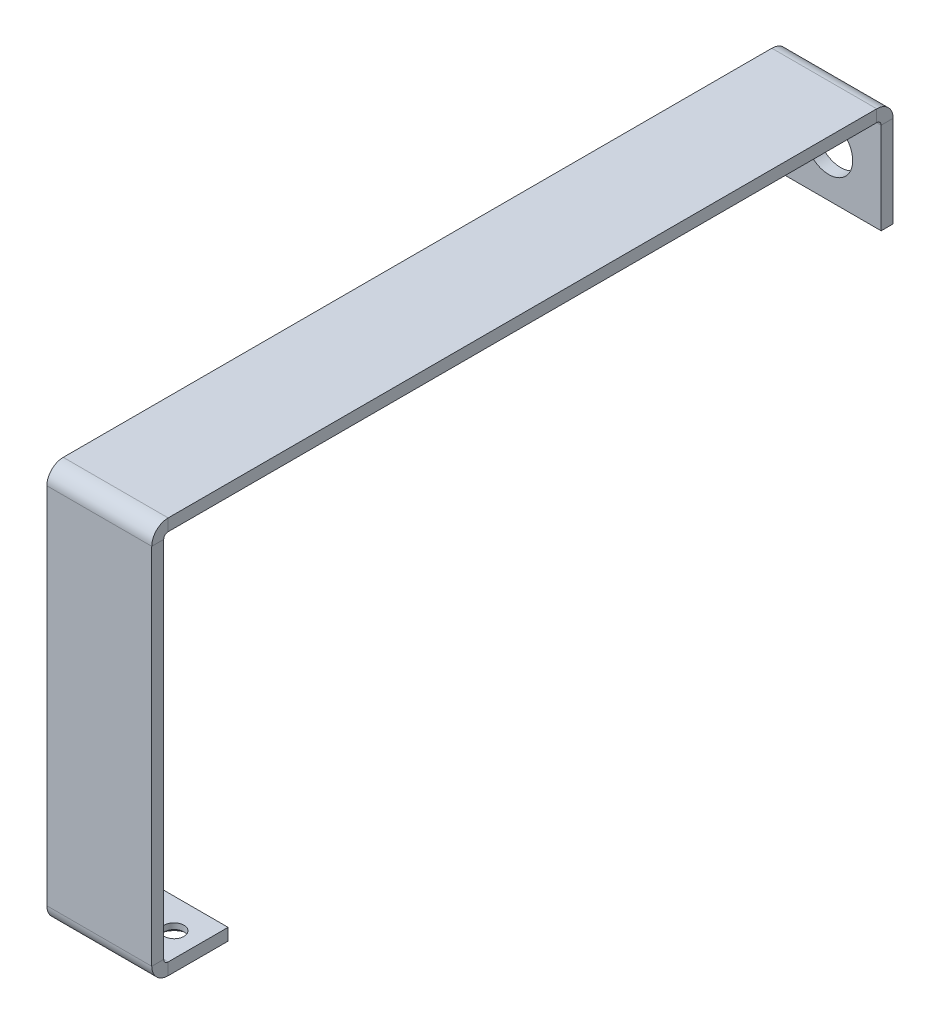
from build123d import *

# Parameters (mm, degrees)
SKETCH1_W                                         = 17.5
SKETCH1_H                                         = 10
BASE_FLANGE1_DEPTH                                = 2
EDGE_FLANGE1_DEPTH                                = 17.5
EDGE_FLANGE2_STRIP_W                              = 9.4732
EDGE_FLANGE2_STRIP_H                              = 2
EDGE_FLANGE2_STRIP_CUT_DEPTH                      = 17.5
EDGE_FLANGE2_DEPTH                                = 17.5
EDGE_FLANGE3_STRIP_W                              = 9.4732
EDGE_FLANGE3_STRIP_H                              = 2
EDGE_FLANGE3_STRIP_CUT_DEPTH                      = 17.5
EDGE_FLANGE3_DEPTH                                = 17.5
SKETCH18_R                                        = 4
CUT_EXTRUDE2_DEPTH                                = 2
CSK_FOR_4_FLAT_HEAD_MACHINE_SCREW_100_D           = 3.2639
CSK_FOR_4_FLAT_HEAD_MACHINE_SCREW_100_DEPTH       = 2
CSK_FOR_4_FLAT_HEAD_MACHINE_SCREW_100_CSINK_D     = 5.715
CSK_FOR_4_FLAT_HEAD_MACHINE_SCREW_100_CSINK_ANGLE = 100
CSK_FOR_4_FLAT_HEAD_MACHINE_SCREW_100_TIP         = 0.980574487


# Sheet-metal steps are written as plain solids
with BuildPart() as part:
    # Sketch1 → Base-Flange1 (new body)
    with BuildSketch(Plane(origin=(0, 0, 0), x_dir=(1, 0, 0), z_dir=(0, 1, 0))):
        Rectangle(SKETCH1_W, SKETCH1_H)
    extrude(amount=BASE_FLANGE1_DEPTH)

    # Edge-Flange1 section (across the edge) → Edge-Flange1 (add)
    with BuildSketch(Plane(origin=(-8.75, 2, 5.7366), x_dir=(0, 0, -1), z_dir=(1, 0, 0))):
        with BuildLine():
            Line((-2, 0.7366), (-2, 64.15))
            Line((-2, 64.15), (0, 64.15))
            Line((0, 64.15), (0, 0.7366))
            ThreePointArc((0, 0.7366), (0.215745145, 0.215745145), (0.7366, 0))
            Line((0.7366, 0), (0.7366, -2))
            ThreePointArc((0.7366, -2), (-1.198468417, -1.198468417), (-2, 0.7366))
        make_face()
    extrude(amount=EDGE_FLANGE1_DEPTH)

    # Edge-Flange2 strip (across the edge) → Edge-Flange2 strip cut (cut)
    with BuildSketch(Plane(origin=(-8.75, 66.15, 5.7366), x_dir=(0, -1, 0), z_dir=(1, 0, 0))):
        with Locations((-2, -1)):
            Rectangle(EDGE_FLANGE2_STRIP_W, EDGE_FLANGE2_STRIP_H)
    extrude(amount=EDGE_FLANGE2_STRIP_CUT_DEPTH, mode=Mode.SUBTRACT)

    # Edge-Flange2 section (across the edge) → Edge-Flange2 (add)
    with BuildSketch(Plane(origin=(-8.75, 66.15, 5.7366), x_dir=(0, -1, 0), z_dir=(1, 0, 0))):
        with BuildLine():
            Line((0, 0.7366), (0, 121.685))
            Line((0, 121.685), (2, 121.685))
            Line((2, 121.685), (2, 0.7366))
            ThreePointArc((2, 0.7366), (2.215745145, 0.215745145), (2.7366, 0))
            Line((2.7366, 0), (2.7366, -2))
            ThreePointArc((2.7366, -2), (0.801531583, -1.198468417), (0, 0.7366))
        make_face()
    extrude(amount=EDGE_FLANGE2_DEPTH)

    # Edge-Flange3 strip (across the edge) → Edge-Flange3 strip cut (cut)
    with BuildSketch(Plane(origin=(-8.75, 64.15, -115.9484), x_dir=(0, 0, 1), z_dir=(1, 0, 0))):
        with Locations((-2, -1)):
            Rectangle(EDGE_FLANGE3_STRIP_W, EDGE_FLANGE3_STRIP_H)
    extrude(amount=EDGE_FLANGE3_STRIP_CUT_DEPTH, mode=Mode.SUBTRACT)

    # Edge-Flange3 section (across the edge) → Edge-Flange3 (add)
    with BuildSketch(Plane(origin=(-8.75, 64.15, -115.9484), x_dir=(0, 0, 1), z_dir=(1, 0, 0))):
        with BuildLine():
            Line((0, 0.7366), (0, 16))
            Line((0, 16), (2, 16))
            Line((2, 16), (2, 0.7366))
            ThreePointArc((2, 0.7366), (2.215745145, 0.215745145), (2.7366, 0))
            Line((2.7366, 0), (2.7366, -2))
            ThreePointArc((2.7366, -2), (0.801531583, -1.198468417), (0, 0.7366))
        make_face()
    extrude(amount=EDGE_FLANGE3_DEPTH)

    # Sketch18 → Cut-Extrude2 (cut)
    with BuildSketch(Plane(origin=(0, 0, -115.9484), x_dir=(-1, 0, 0), z_dir=(0, 0, -1))):
        with Locations(Location((0, 55.9134, 0), (0, 0, 90))):
            Circle(SKETCH18_R)
    extrude(amount=-CUT_EXTRUDE2_DEPTH, mode=Mode.SUBTRACT)

    # CSK for #4 Flat Head Machine Screw (100)1
    with Locations(Plane.XZ):
        with Locations((4.75, 0), (-4.75, 0)):
            CounterSinkHole(CSK_FOR_4_FLAT_HEAD_MACHINE_SCREW_100_D / 2, CSK_FOR_4_FLAT_HEAD_MACHINE_SCREW_100_CSINK_D / 2, depth=CSK_FOR_4_FLAT_HEAD_MACHINE_SCREW_100_DEPTH, counter_sink_angle=CSK_FOR_4_FLAT_HEAD_MACHINE_SCREW_100_CSINK_ANGLE)
            with Locations((0, 0, -(CSK_FOR_4_FLAT_HEAD_MACHINE_SCREW_100_DEPTH + CSK_FOR_4_FLAT_HEAD_MACHINE_SCREW_100_TIP / 2))):  # 118° drill point
                Cone(0, CSK_FOR_4_FLAT_HEAD_MACHINE_SCREW_100_D / 2, CSK_FOR_4_FLAT_HEAD_MACHINE_SCREW_100_TIP, mode=Mode.SUBTRACT)


solid = part.part
